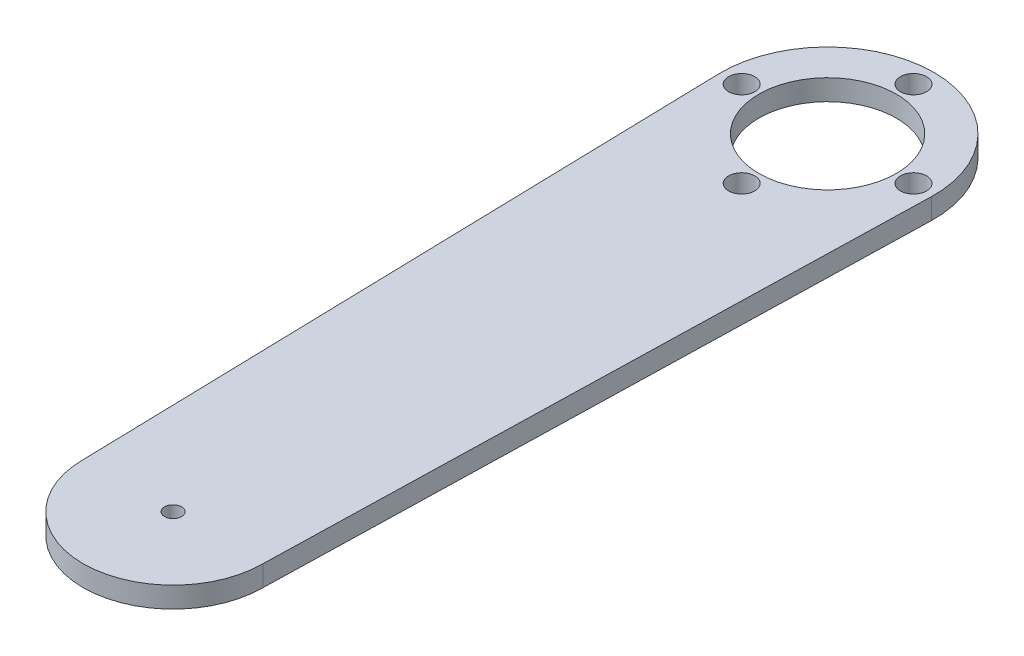
from build123d import *

# Parameters (mm, degrees)
BOSS_EXTRUDE1_DEPTH     = 6.35
SKETCH2_R               = 2.6
CUT_EXTRUDE1_DEPTH      = 235.846380641
ESQUISSE3_R             = 21
ENL_V_MAT_EXTRU_2_DEPTH = 235.846380641
ESQUISSE7_R             = 4
ENL_V_MAT_EXTRU_3_DEPTH = 235.846380641


with BuildPart() as part:
    # Sketch1 → Boss-Extrude1 (new body)
    with BuildSketch(Plane(origin=(0, 0, 0), x_dir=(1, 0, 0), z_dir=(0, 1, 0))):
        with BuildLine():
            ThreePointArc((-27.5, 0), (0, -27.5), (27.5, 0))
            Line((27.5, 0), (32.489807083, 199.186098474))
            ThreePointArc((32.489807083, 199.186098474), (0, 232.5), (-32.489807083, 199.186098474))
            Line((-32.489807083, 199.186098474), (-27.5, 0))
        make_face()
    extrude(amount=BOSS_EXTRUDE1_DEPTH)

    # Sketch2 → Cut-Extrude1 (cut, through all)
    with BuildSketch(Plane(origin=(0, 6.35, 0), x_dir=(1, 0, 0), z_dir=(0, 1, 0))):
        Circle(SKETCH2_R)
    extrude(amount=-CUT_EXTRUDE1_DEPTH, mode=Mode.SUBTRACT)

    # Esquisse3 → Enlèv. mat.-Extru.2 (cut, through all)
    with BuildSketch(Plane(origin=(0, 6.35, 0), x_dir=(1, 0, 0), z_dir=(0, 1, 0))):
        with Locations((0, 200)):
            Circle(ESQUISSE3_R)
    extrude(amount=-ENL_V_MAT_EXTRU_2_DEPTH, mode=Mode.SUBTRACT)

    # Esquisse7 → Enlèv. mat.-Extru.3 (cut, through all)
    with BuildSketch(Plane(origin=(0, 6.35, 0), x_dir=(1, 0, 0), z_dir=(0, 1, 0))):
        with Locations((0, 226.25)):
            Circle(ESQUISSE7_R)
        with Locations((26.25, 200)):
            Circle(ESQUISSE7_R)
        with Locations((0, 173.75)):
            Circle(ESQUISSE7_R)
        with Locations((-26.25, 200)):
            Circle(ESQUISSE7_R)
    extrude(amount=-ENL_V_MAT_EXTRU_3_DEPTH, mode=Mode.SUBTRACT)


solid = part.part
